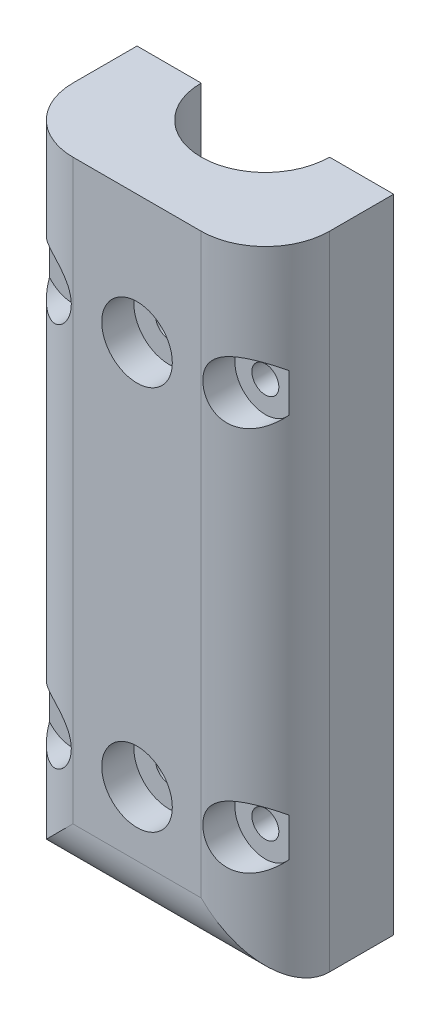
from build123d import *

# Parameters (mm, degrees)
SKETCH3_W           = 40
SKETCH3_H           = 100
BOSS_EXTRUDE1_DEPTH = 20
SKETCH4_R           = 10
CUT_EXTRUDE1_DEPTH  = 104.923048454
SKETCH6_R           = 5.5
SKETCH6_R_2         = 2.1
SKETCH6_R_3         = 4.75
CUT_EXTRUDE10_DEPTH = 5
SKETCH6_2_R         = 2.1
CUT_EXTRUDE11_DEPTH = 58.445626465
FILLET1_R           = 10


with BuildPart() as part:
    # Sketch3 → Boss-Extrude1 (new body)
    with BuildSketch(Plane.XY):
        Rectangle(SKETCH3_W, SKETCH3_H)
    extrude(amount=BOSS_EXTRUDE1_DEPTH)

    # Sketch4 → Cut-Extrude1 (cut, through all)
    with BuildSketch(Plane(origin=(0, 50, 0), x_dir=(1, 0, 0), z_dir=(0, 1, 0))):
        Circle(SKETCH4_R)
    extrude(amount=-CUT_EXTRUDE1_DEPTH, mode=Mode.SUBTRACT)

    # Sketch6 → Cut-Extrude10 (cut)
    # profile 1 of 6: a face of its own
    with BuildSketch(Plane.XY.offset(20)):
        with Locations((0, 30)):
            Circle(SKETCH6_R)
        with Locations((0, 30)):
            Circle(SKETCH6_R_2, mode=Mode.SUBTRACT)
    # profile 2 of 6: a face of its own
    with BuildSketch(Plane.XY.offset(20)):
        with Locations((0, -30)):
            Circle(SKETCH6_R)
        with Locations((0, -30)):
            Circle(SKETCH6_R_2, mode=Mode.SUBTRACT)
    # profile 3 of 6: a face of its own
    with BuildSketch(Plane.XY.offset(20)):
        with Locations((-15, 30)):
            Circle(SKETCH6_R_3)
        with Locations((-15, 30)):
            Circle(SKETCH6_R_2, mode=Mode.SUBTRACT)
    # profile 4 of 6: a face of its own
    with BuildSketch(Plane.XY.offset(20)):
        with Locations((-15, -30)):
            Circle(SKETCH6_R_3)
        with Locations((-15, -30)):
            Circle(SKETCH6_R_2, mode=Mode.SUBTRACT)
    # profile 5 of 6: a face of its own
    with BuildSketch(Plane.XY.offset(20)):
        with Locations(Location((15, -30, 0), (0, 0, 180))):
            Circle(SKETCH6_R_3)
        with Locations(Location((15, -30, 0), (0, 0, 180))):
            Circle(SKETCH6_R_2, mode=Mode.SUBTRACT)
    # profile 6 of 6: a face of its own
    with BuildSketch(Plane.XY.offset(20)):
        with Locations(Location((15, 30, 0), (0, 0, 180))):
            Circle(SKETCH6_R_3)
        with Locations(Location((15, 30, 0), (0, 0, 180))):
            Circle(SKETCH6_R_2, mode=Mode.SUBTRACT)
    extrude(amount=-CUT_EXTRUDE10_DEPTH, mode=Mode.SUBTRACT)

    # Sketch6<2> → Cut-Extrude11 (cut, through all)
    with BuildSketch(Plane.XY.offset(20)):
        with Locations((0, 30)):
            Circle(SKETCH6_2_R)
        with Locations((0, -30)):
            Circle(SKETCH6_2_R)
        with Locations((-15, 30)):
            Circle(SKETCH6_2_R)
        with Locations((-15, -30)):
            Circle(SKETCH6_2_R)
        with Locations(Location((15, -30, 0), (0, 0, 180))):
            Circle(SKETCH6_2_R)
        with Locations(Location((15, 30, 0), (0, 0, 180))):
            Circle(SKETCH6_2_R)
    extrude(amount=-CUT_EXTRUDE11_DEPTH, mode=Mode.SUBTRACT)

    # Fillet1
    # the kernel refuses this fillet: 10 mm, written as the material it takes off along each edge
    with BuildSketch(Plane(origin=(-45, -50, 20), x_dir=(0, 0, -1), z_dir=(1, 0, 0))) as fillet1_piece_1:
        with BuildLine():
            CenterArc((FILLET1_R, FILLET1_R), FILLET1_R, 180, 90)
            Line((0, FILLET1_R), (0, 0))
            Line((0, 0), (FILLET1_R, 0))
        make_face()
    extrude(amount=90, mode=Mode.SUBTRACT)
    with BuildSketch(Plane(origin=(20, -75, 20), x_dir=(0, 0, -1), z_dir=(0, 1, 0))) as fillet1_piece_2:
        with BuildLine():
            CenterArc((FILLET1_R, FILLET1_R), FILLET1_R, 180, 90)
            Line((0, FILLET1_R), (0, 0))
            Line((0, 0), (FILLET1_R, 0))
        make_face()
    extrude(amount=150, mode=Mode.SUBTRACT)
    with BuildSketch(Plane(origin=(-20, 75, 20), x_dir=(1, 0, 0), z_dir=(0, -1, 0))) as fillet1_piece_3:
        with BuildLine():
            CenterArc((FILLET1_R, -FILLET1_R), FILLET1_R, 90, 90)
            Line((0, -FILLET1_R), (0, 0))
            Line((0, 0), (FILLET1_R, 0))
        make_face()
    extrude(amount=150, mode=Mode.SUBTRACT)


solid = part.part
